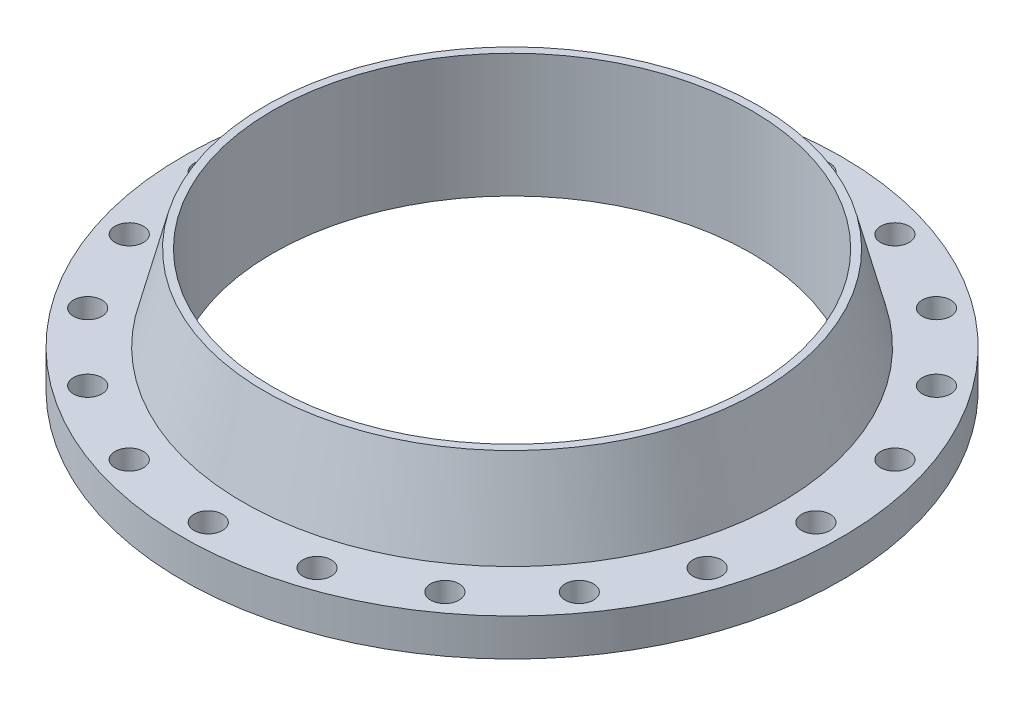
from build123d import *

# Parameters (mm, degrees)
SKETCH10_R         = 0.69
CUT_EXTRUDE1_DEPTH = 6.81
CIRPATTERN1_COUNT  = 20


with BuildPart() as part:
    # Sketch8 → Revolve1 (revolve)
    with BuildSketch(Plane.XY):
        Polygon((-11.625, 0), (-11.625, 5.94), (-12, 5.94), (-13.06, 1.81), (-16, 1.81), (-16, 0), (-13.625, 0), (-13.625, -0.0625), (-11.625, -0.0625), align=None)
    revolve(axis=Axis((0, 0, 0), (0, 1, 0)))

    # Sketch10 → Cut-Extrude1 (cut)
    with BuildSketch(Plane(origin=(0, 0, 0), x_dir=(1, 0, 0), z_dir=(0, 1, 0))):
        with Locations((0, 14.75)):
            Circle(SKETCH10_R)
    cut_extrude1 = extrude(amount=CUT_EXTRUDE1_DEPTH, mode=Mode.SUBTRACT)

    # CirPattern1: Cut-Extrude1 ×20 about axis
    cirpattern1_axis = Axis((0, 0, 0), (0, 1, 0))
    for i in range(1, CIRPATTERN1_COUNT):
        add(cut_extrude1.rotate(cirpattern1_axis, i * 360 / CIRPATTERN1_COUNT), mode=Mode.SUBTRACT)


solid = part.part
